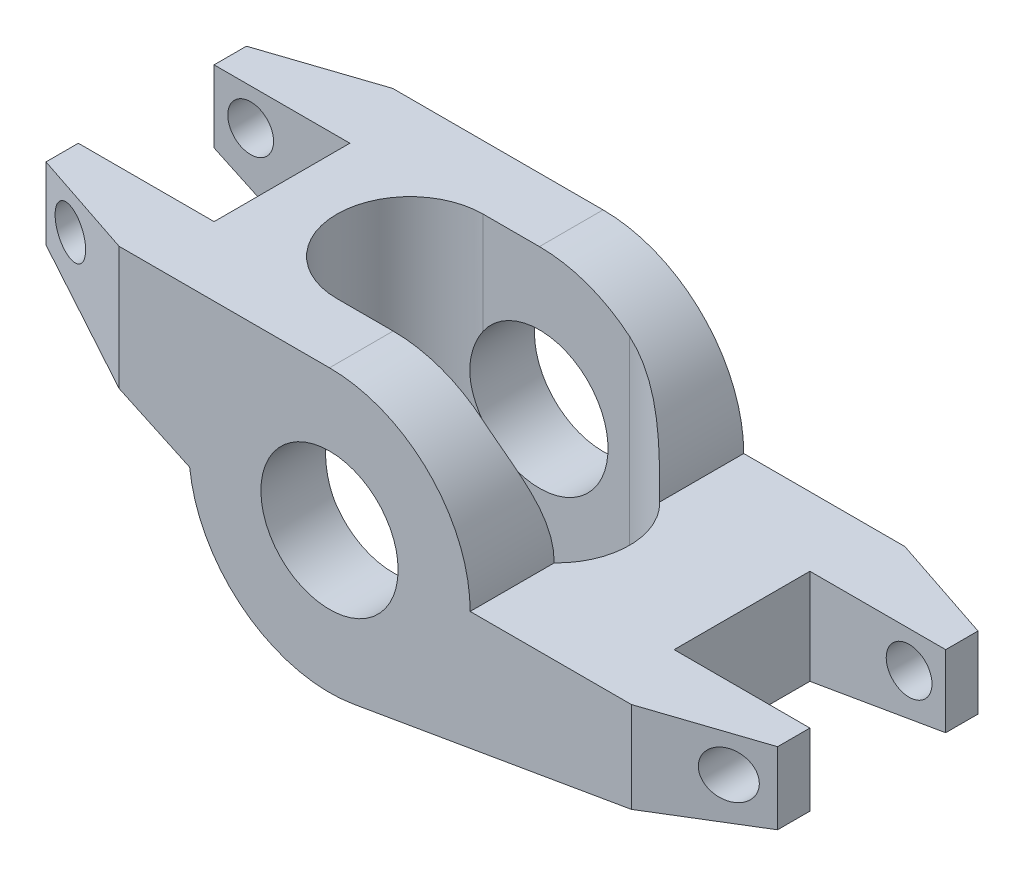
from build123d import *

# Parameters (mm, degrees)
SKETCH1_R           = 4.765
BOSS_EXTRUDE1_DEPTH = 9.5
SKETCH3_W           = 9.43
SKETCH3_H           = 9.43
CUT_EXTRUDE1_DEPTH  = 36.900947063
CUT_EXTRUDE2_DEPTH  = 36.900947063
SKETCH5_R           = 1.59
CUT_EXTRUDE3_DEPTH  = 36.682899346
CHAMFER1_SIZE       = 2.54
CHAMFER1_SIZE_2     = 7.62
CHAMFER2_SIZE       = 7.62
CHAMFER2_SIZE_2     = 2.54


with BuildPart() as part:
    # Sketch1 → Boss-Extrude1 (new, symmetric)
    with BuildSketch(Plane.XY):
        with BuildLine():
            Line((0, 9.77), (-22.23, 9.77))
            Line((-22.23, 9.77), (-22.23, 4.77))
            Line((-22.23, 4.77), (-9.711509246, -1.067468107))
            ThreePointArc((-9.711509246, -1.067468107), (-5.877874817, -7.804068659), (1.655323868, -9.628748771))
            Line((1.655323868, -9.628748771), (28.58, -5))
            Line((28.58, -5), (28.58, 0))
            Line((28.58, 0), (9.77, 0))
            ThreePointArc((9.77, 0), (6.908433252, 6.908433252), (0, 9.77))
        make_face()
        Circle(SKETCH1_R, mode=Mode.SUBTRACT)
    extrude(amount=BOSS_EXTRUDE1_DEPTH, both=True)

    # Sketch3 → Cut-Extrude1 (cut, through all)
    with BuildSketch(Plane(origin=(0, 9.77, 0), x_dir=(1, 0, 0), z_dir=(0, 1, 0))):
        with Locations((-17.515, 0)):
            Rectangle(SKETCH3_W, SKETCH3_H)
        with Locations((23.865, 0)):
            Rectangle(SKETCH3_W, SKETCH3_H)
    extrude(amount=-CUT_EXTRUDE1_DEPTH, mode=Mode.SUBTRACT)

    # Sketch4 → Cut-Extrude2 (cut, through all)
    with BuildSketch(Plane(origin=(0, 9.77, 0), x_dir=(1, 0, 0), z_dir=(0, 1, 0))):
        with BuildLine():
            Line((-3.91, 5.08), (6.25, 5.08))
            ThreePointArc((6.25, 5.08), (11.33, 0), (6.25, -5.08))
            Line((6.25, -5.08), (-3.91, -5.08))
            ThreePointArc((-3.91, -5.08), (-8.99, 0), (-3.91, 5.08))
        make_face()
    extrude(amount=-CUT_EXTRUDE2_DEPTH, mode=Mode.SUBTRACT)

    # Sketch5 → Cut-Extrude3 (cut, through all)
    with BuildSketch(Plane.XY.offset(9.5)):
        with Locations((-19.69, 7.23)):
            Circle(SKETCH5_R)
        with Locations((26.04, -2.54)):
            Circle(SKETCH5_R)
    extrude(amount=-CUT_EXTRUDE3_DEPTH, mode=Mode.SUBTRACT)

    # Chamfer1
    # the kernel refuses this chamfer: 7.62, 2.54 mm, written as the material it takes off along each edge
    with BuildSketch(Plane(origin=(-22.23, 29.544364901, -9.5), x_dir=(-0.1090261201798072, 0, 0.9940388851139267), z_dir=(0, -1, 0))) as chamfer1_piece_1:
        Polygon((CHAMFER1_SIZE * 0.994038885114, -CHAMFER1_SIZE * 0.10902612018), (-CHAMFER1_SIZE_2 * 0.10902612018, -CHAMFER1_SIZE_2 * 0.994038885114), (0, 0), align=None)
    extrude(amount=44.548729802, mode=Mode.SUBTRACT)
    with BuildSketch(Plane(origin=(28.58, -24.774364901, -9.5), x_dir=(-0.9999257509361695, 0, -0.012185754582199181), z_dir=(0, 1, 0))) as chamfer1_piece_2:
        Polygon((CHAMFER1_SIZE_2 * 0.999925750936, CHAMFER1_SIZE_2 * 0.0121857545822), (-CHAMFER1_SIZE * 0.0121857545822, CHAMFER1_SIZE * 0.999925750936), (0, 0), align=None)
    extrude(amount=44.548729802, mode=Mode.SUBTRACT)

    # Chamfer2
    # the kernel refuses this chamfer: 7.62, 2.54 mm, written as the material it takes off along each edge
    with BuildSketch(Plane(origin=(-22.23, 29.544364901, 9.5), x_dir=(0.9999257509361695, 0, 0.012185754582199181), z_dir=(0, -1, 0)), Plane(origin=(28.58, -24.774364901, 9.5), x_dir=(-0.9999257509361695, 0, 0.012185754582199181), z_dir=(0, 1, 0))) as chamfer2_piece_1:
        Polygon((CHAMFER2_SIZE * 0.999925750936, -CHAMFER2_SIZE * 0.0121857545822), (-CHAMFER2_SIZE_2 * 0.0121857545822, -CHAMFER2_SIZE_2 * 0.999925750936), (0, 0), align=None)
    extrude(amount=44.548729802, mode=Mode.SUBTRACT)


solid = part.part
